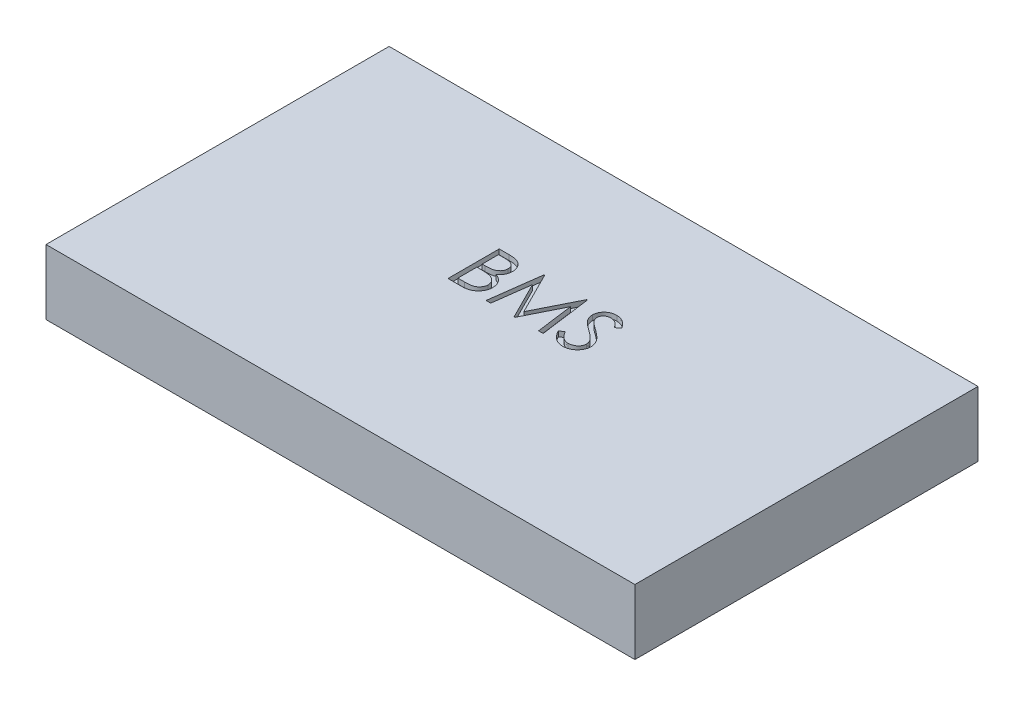
from build123d import *

# Parameters (mm, degrees)
SKETCH1_W           = 115
SKETCH1_H           = 67
BOSS_EXTRUDE1_DEPTH = 12.7
CUT_EXTRUDE1_DEPTH  = 1


with BuildPart() as part:
    # Sketch1 → Boss-Extrude1 (new body)
    with BuildSketch(Plane(origin=(0, 0, 0), x_dir=(1, 0, 0), z_dir=(0, 1, 0))):
        with Locations((57.5, 33.5)):
            Rectangle(SKETCH1_W, SKETCH1_H)
    extrude(amount=BOSS_EXTRUDE1_DEPTH)

    # Sketch2 → Cut-Extrude1 (cut)
    # profile 1 of 3: a face of its own
    with BuildSketch(Plane(origin=(0, 12.7, 0), x_dir=(1, 0, 0), z_dir=(0, 1, 0))):
        with BuildLine():
            Line((45, 43.5), (46.951121795, 43.5))
            add(Edge.make_bspline(
                [(46.951121795, 43.5), (47.046631733, 43.499497856), (47.231753762, 43.498524576), (47.500952167, 43.483429916), (47.753091626, 43.462848002), (47.988245262, 43.430190594), (48.206304411, 43.390785516), (48.407926232, 43.343066042), (48.592469581, 43.285847146), (48.812791685, 43.194857771), (49.063993574, 43.059648718), (49.335988981, 42.859852818), (49.568572522, 42.615474352), (49.769104857, 42.339809622), (49.928536628, 42.03656456), (50.043877477, 41.712966878), (50.116899978, 41.373190472), (50.12440979, 41.13992425), (50.128205128, 41.022035256)],
                knots=[0, 0, 0, 0, 1.001505555, 1.941167018, 2.826882275, 3.653841531, 4.429895133, 5.150066043, 5.825578002, 6.45369114, 7.647487171, 8.808567382, 9.977351308, 11.170798116, 12.373658725, 13.556498008, 14.765093433, 16, 16, 16, 16], degree=3))
            add(Edge.make_bspline(
                [(50.128205128, 41.022035256), (50.125081647, 40.911599383), (50.118943712, 40.694582477), (50.060250114, 40.377170736), (49.968362489, 40.075024397), (49.840633206, 39.789246153), (49.674627503, 39.526292972), (49.477889449, 39.284043641), (49.240527157, 39.072754907), (49.062689328, 38.954632328), (48.972355769, 38.89463141)],
                knots=[0, 0, 0, 0, 1.044552857, 2.05264487, 3.044412934, 4.028983338, 5.005914585, 5.980388656, 6.974128949, 8, 8, 8, 8], degree=3))
            add(Edge.make_bspline(
                [(48.972355769, 38.89463141), (49.085956991, 38.851017128), (49.303304269, 38.767572201), (49.602407162, 38.620042304), (49.860106719, 38.459579131), (50.078384279, 38.284345273), (50.265063293, 38.095462957), (50.428071697, 37.890162631), (50.567161338, 37.665766179), (50.68634112, 37.424613221), (50.779337565, 37.169166169), (50.848983006, 36.901821094), (50.888890004, 36.623536651), (50.894568979, 36.434149853), (50.897435897, 36.338541667)],
                knots=[0, 0, 0, 0, 1.27268992, 2.434971085, 3.483601985, 4.442670788, 5.356604649, 6.2567628, 7.179492994, 8.113709626, 9.066344395, 10.018646069, 10.999752585, 12, 12, 12, 12], degree=3))
            add(Edge.make_bspline(
                [(50.897435897, 36.338541667), (50.894644909, 36.240922032), (50.88915356, 36.048852666), (50.848639355, 35.766695139), (50.780041907, 35.497052434), (50.685552917, 35.238180484), (50.562232018, 34.990580099), (50.41215212, 34.753970774), (50.233204796, 34.530729829), (50.03302517, 34.31837662), (49.806561897, 34.127440085), (49.562231169, 33.957395209), (49.296955969, 33.817549317), (49.015093129, 33.70007497), (48.713480797, 33.610340117), (48.393473348, 33.547561334), (48.055346771, 33.505261229), (47.823318911, 33.5017835), (47.704326923, 33.5)],
                knots=[0, 0, 0, 0, 0.978564426, 1.925352924, 2.850884081, 3.763762016, 4.682927383, 5.618979971, 6.567305752, 7.547517671, 8.540179244, 9.531824382, 10.526200242, 11.540722885, 12.589160233, 13.674978461, 14.80764778, 16, 16, 16, 16], degree=3))
            Line((47.704326923, 33.5), (45, 33.5))
            Line((45, 33.5), (45, 43.5))
        make_face()
        with BuildLine():
            Line((45.897435897, 42.474358974), (45.897435897, 39.269230769))
            Line((45.897435897, 39.269230769), (46.500400641, 39.269230769))
            add(Edge.make_bspline(
                [(46.500400641, 39.269230769), (46.588540056, 39.270373406), (46.758843369, 39.272581214), (47.005471644, 39.278905549), (47.234400268, 39.296614244), (47.445234077, 39.31431785), (47.637641059, 39.343102386), (47.811194949, 39.377365595), (47.968619512, 39.413602466), (48.150161071, 39.475229572), (48.356083781, 39.566308644), (48.575606935, 39.707656747), (48.769133991, 39.876012042), (48.932554528, 40.070271932), (49.066301586, 40.284175321), (49.159197915, 40.514309265), (49.222190156, 40.754938213), (49.227880245, 40.920133221), (49.230769231, 41.00400641)],
                knots=[0, 0, 0, 0, 1.156816544, 2.235205308, 3.236616184, 4.169592532, 5.011045266, 5.787822928, 6.49130361, 7.128639758, 8.301311294, 9.436451833, 10.541879658, 11.654887649, 12.756523258, 13.837046038, 14.901820046, 16, 16, 16, 16], degree=3))
            add(Edge.make_bspline(
                [(49.230769231, 41.00400641), (49.229265859, 41.059508615), (49.226316831, 41.168382249), (49.202164537, 41.32709469), (49.161114325, 41.476362554), (49.108387773, 41.618231441), (49.034705805, 41.748265298), (48.947953053, 41.870960143), (48.843136795, 41.982137625), (48.723830187, 42.086050477), (48.586662693, 42.178177699), (48.431716145, 42.258865594), (48.256894211, 42.323839242), (48.065143196, 42.380742534), (47.853511518, 42.420709088), (47.624441365, 42.454004482), (47.376056454, 42.470955173), (47.204213304, 42.473199067), (47.115384615, 42.474358974)],
                knots=[0, 0, 0, 0, 0.91205012, 1.789085906, 2.630437955, 3.453916878, 4.269457761, 5.079663411, 5.91843418, 6.774407191, 7.675494373, 8.627863946, 9.638891023, 10.736472738, 11.911756761, 13.175263542, 14.539845004, 16, 16, 16, 16], degree=3))
            Line((47.115384615, 42.474358974), (45.897435897, 42.474358974))
        make_face(mode=Mode.SUBTRACT)
        with BuildLine():
            Line((45.897435897, 38.243589744), (45.897435897, 34.525641026))
            Line((45.897435897, 34.525641026), (47.175480769, 34.525641026))
            add(Edge.make_bspline(
                [(47.175480769, 34.525641026), (47.266963415, 34.526737447), (47.443284153, 34.528850654), (47.697859097, 34.535749381), (47.933810822, 34.551441598), (48.150062638, 34.576144025), (48.348949646, 34.602939594), (48.52808594, 34.638971825), (48.688923636, 34.68025457), (48.875421658, 34.74406649), (49.085431681, 34.843199265), (49.311748414, 34.992668483), (49.51296618, 35.170735076), (49.683838349, 35.376823403), (49.823875459, 35.600912908), (49.925748188, 35.838471051), (49.988579207, 36.085572558), (49.996185405, 36.254048879), (50, 36.338541667)],
                knots=[0, 0, 0, 0, 1.160039823, 2.235823828, 3.228722157, 4.157150951, 4.99529583, 5.772374946, 6.472645482, 7.099169577, 8.269452708, 9.405989375, 10.527446681, 11.663510218, 12.788923519, 13.866172445, 14.929861265, 16, 16, 16, 16], degree=3))
            add(Edge.make_bspline(
                [(50, 36.338541667), (49.99921113, 36.391379782), (49.997646116, 36.49620373), (49.974044359, 36.650248928), (49.939719017, 36.799465709), (49.895343491, 36.944259253), (49.830716443, 37.082011757), (49.755269171, 37.215447641), (49.666808023, 37.344743297), (49.52896755, 37.508206878), (49.328476165, 37.696541201), (49.043599664, 37.880934064), (48.719678813, 38.029642085), (48.484743119, 38.092783446), (48.36338141, 38.125400641)],
                knots=[0, 0, 0, 0, 0.723448775, 1.435228256, 2.130040452, 2.821711965, 3.505591119, 4.210454504, 4.921174351, 5.648778258, 7.137944449, 8.670945889, 10.280296675, 12, 12, 12, 12], degree=3))
            add(Edge.make_bspline(
                [(48.36338141, 38.125400641), (48.314726851, 38.135272309), (48.20923373, 38.156676123), (48.037212071, 38.179269561), (47.840823874, 38.199398304), (47.619615654, 38.214287326), (47.373307536, 38.22967745), (47.101373483, 38.235662653), (46.804924012, 38.242803396), (46.59923152, 38.243320923), (46.492387821, 38.243589744)],
                knots=[0, 0, 0, 0, 0.634451884, 1.375622551, 2.216452059, 3.157844607, 4.20941857, 5.370758133, 6.634282058, 8, 8, 8, 8], degree=3))
            Line((46.492387821, 38.243589744), (45.897435897, 38.243589744))
        make_face(mode=Mode.SUBTRACT)
    # profile 2 of 3: a face of its own
    with BuildSketch(Plane(origin=(0, 12.7, 0), x_dir=(1, 0, 0), z_dir=(0, 1, 0))):
        Polygon((52.435897436, 33.5), (53.756009615, 43.5), (53.884214744, 43.5), (58.012820513, 35.294871795), (62.129407051, 43.5), (62.257612179, 43.5), (63.58974359, 33.5), (62.692307692, 33.5), (61.730769231, 40.689503205), (58.122996795, 33.5), (57.918669872, 33.5), (54.294871795, 40.711538462), (53.339342949, 33.5), align=None)
    # profile 3 of 3: a face of its own
    with BuildSketch(Plane(origin=(0, 12.7, 0), x_dir=(1, 0, 0), z_dir=(0, 1, 0))):
        with BuildLine():
            Line((64.615384615, 35.429086538), (65.460737179, 35.935897436))
            add(Edge.make_bspline(
                [(65.460737179, 35.935897436), (65.539360714, 35.804284907), (65.690000373, 35.552120382), (65.941289971, 35.211383124), (66.201669717, 34.921776961), (66.473067813, 34.684986654), (66.753827665, 34.498561264), (67.045782104, 34.366554887), (67.347947278, 34.284223529), (67.553586767, 34.274223282), (67.65625, 34.269230769)],
                knots=[0, 0, 0, 0, 1.272034388, 2.437168799, 3.508375237, 4.49857839, 5.41946034, 6.295179144, 7.148887113, 8, 8, 8, 8], degree=3))
            add(Edge.make_bspline(
                [(67.65625, 34.269230769), (67.743926744, 34.271672691), (67.917746096, 34.276513806), (68.173638219, 34.323030383), (68.422157654, 34.394493608), (68.658182333, 34.496839127), (68.878455517, 34.620663372), (69.071617504, 34.770223879), (69.238606399, 34.937670181), (69.375203869, 35.124477766), (69.48000397, 35.325383905), (69.560552737, 35.531600909), (69.605252947, 35.746368247), (69.611986528, 35.890969569), (69.615384615, 35.963942308)],
                knots=[0, 0, 0, 0, 1.095163259, 2.171163733, 3.241058638, 4.321873601, 5.38011039, 6.391990106, 7.366004449, 8.327778327, 9.272591725, 10.192022065, 11.087607919, 12, 12, 12, 12], degree=3))
            add(Edge.make_bspline(
                [(69.615384615, 35.963942308), (69.611172299, 36.047201878), (69.602609276, 36.216456419), (69.530233618, 36.466169713), (69.416378627, 36.713291342), (69.311342502, 36.8661521), (69.256810897, 36.945512821)],
                knots=[0, 0, 0, 0, 0.938893495, 1.908633276, 2.914225137, 4, 4, 4, 4], degree=3))
            add(Edge.make_bspline(
                [(69.256810897, 36.945512821), (69.212037714, 37.002789459), (69.118042016, 37.123034598), (68.956449123, 37.302020985), (68.766831654, 37.486645039), (68.555678639, 37.683956631), (68.315298386, 37.884778907), (68.053219773, 38.098688272), (67.762751605, 38.317549921), (67.559038757, 38.46432868), (67.453926282, 38.540064103)],
                knots=[0, 0, 0, 0, 0.722233717, 1.516239348, 2.393582979, 3.351407094, 4.387010283, 5.505090956, 6.712668013, 8, 8, 8, 8], degree=3))
            add(Edge.make_bspline(
                [(67.453926282, 38.540064103), (67.348714864, 38.615002924), (67.147558646, 38.758280245), (66.86624841, 38.970921057), (66.614692802, 39.165332112), (66.394009897, 39.343343575), (66.204296764, 39.504979589), (66.044058446, 39.648687987), (65.917376855, 39.778355303), (65.846932338, 39.862473423), (65.815304487, 39.900240385)],
                knots=[0, 0, 0, 0, 1.452282411, 2.77665338, 3.964542531, 5.026858415, 5.96415736, 6.766646006, 7.446254459, 8, 8, 8, 8], degree=3))
            add(Edge.make_bspline(
                [(65.815304487, 39.900240385), (65.771097215, 39.95910049), (65.684157682, 40.074856786), (65.569397666, 40.255784951), (65.471857201, 40.440994281), (65.395393395, 40.630982466), (65.331004198, 40.823082262), (65.287695825, 41.019800107), (65.260577548, 41.220253303), (65.257800443, 41.355149019), (65.256410256, 41.422676282)],
                knots=[0, 0, 0, 0, 1.068054152, 2.10047183, 3.106115577, 4.101338837, 5.06977816, 6.043150881, 7.020423561, 8, 8, 8, 8], degree=3))
            add(Edge.make_bspline(
                [(65.256410256, 41.422676282), (65.260139425, 41.528475638), (65.267518054, 41.737812963), (65.329919532, 42.043615336), (65.428413513, 42.335576528), (65.566398907, 42.610806053), (65.744277059, 42.862137427), (65.9501227, 43.092461675), (66.195298375, 43.286086196), (66.46430587, 43.455263505), (66.758752647, 43.587680435), (67.067298085, 43.687568949), (67.390432577, 43.744166828), (67.609298676, 43.752289014), (67.720352564, 43.756410256)],
                knots=[0, 0, 0, 0, 1.005424448, 1.989358655, 2.955360095, 3.929531133, 4.905563448, 5.876582895, 6.856512386, 7.866279853, 8.892233794, 9.918561126, 10.94386622, 12, 12, 12, 12], degree=3))
            add(Edge.make_bspline(
                [(67.720352564, 43.756410256), (67.838192851, 43.752345823), (68.07253957, 43.744262963), (68.417251614, 43.673984302), (68.749139376, 43.557696668), (69.016120132, 43.425729074), (69.225070879, 43.293925029), (69.384421544, 43.173868388), (69.545899975, 43.035653792), (69.710808703, 42.878913089), (69.876353444, 42.702208086), (70.044991879, 42.506748975), (70.217118362, 42.293730244), (70.32784939, 42.141660242), (70.384615385, 42.063701923)],
                knots=[0, 0, 0, 0, 1.286793592, 2.559021753, 3.825965368, 5.121522368, 5.803751409, 6.523245864, 7.299691795, 8.125521123, 9.008227632, 9.944561021, 10.946284179, 12, 12, 12, 12], degree=3))
            Line((70.384615385, 42.063701923), (69.573317308, 41.448717949))
            add(Edge.make_bspline(
                [(69.573317308, 41.448717949), (69.524328929, 41.511828493), (69.429988766, 41.633364645), (69.286761661, 41.803568404), (69.151765524, 41.95904406), (69.018764382, 42.094087282), (68.894782577, 42.216093378), (68.774448171, 42.320549826), (68.659492882, 42.408480098), (68.514587423, 42.502318841), (68.332536799, 42.595337423), (68.104009553, 42.674049074), (67.865191624, 42.721349251), (67.702535534, 42.727603216), (67.620192308, 42.730769231)],
                knots=[0, 0, 0, 0, 1.181633172, 2.275549214, 3.290209073, 4.226197932, 5.078386478, 5.862611352, 6.581680152, 7.217281963, 8.414376989, 9.595101626, 10.782541182, 12, 12, 12, 12], degree=3))
            add(Edge.make_bspline(
                [(67.620192308, 42.730769231), (67.516887958, 42.727307231), (67.317675251, 42.72063109), (67.034846005, 42.647716847), (66.780291933, 42.532911531), (66.561570319, 42.372011594), (66.37946467, 42.181380186), (66.247734788, 41.962012029), (66.168448604, 41.719776593), (66.158773519, 41.550800432), (66.153846154, 41.46474359)],
                knots=[0, 0, 0, 0, 1.14458467, 2.207223713, 3.21896685, 4.227309161, 5.202851033, 6.127160689, 7.046193047, 8, 8, 8, 8], degree=3))
            add(Edge.make_bspline(
                [(66.153846154, 41.46474359), (66.154969373, 41.411167937), (66.157217647, 41.303929024), (66.188574212, 41.14549639), (66.228858009, 40.987463992), (66.2926941, 40.830542326), (66.380823539, 40.671987015), (66.496552613, 40.509067765), (66.642304933, 40.340348597), (66.75395354, 40.230613243), (66.812900641, 40.172676282)],
                knots=[0, 0, 0, 0, 0.858281714, 1.717966888, 2.583508476, 3.4729293, 4.427298488, 5.488583878, 6.674047936, 8, 8, 8, 8], degree=3))
            add(Edge.make_bspline(
                [(66.812900641, 40.172676282), (66.834790276, 40.153141923), (66.88679504, 40.106732756), (66.981869113, 40.030754811), (67.107419965, 39.937032605), (67.260169112, 39.821068843), (67.442933002, 39.68655038), (67.655731734, 39.535197203), (67.896193256, 39.362095891), (68.066827302, 39.241074346), (68.157051282, 39.177083333)],
                knots=[0, 0, 0, 0, 0.420754252, 0.999615792, 1.744751191, 2.668019286, 3.750313428, 4.999500688, 6.413464383, 8, 8, 8, 8], degree=3))
            add(Edge.make_bspline(
                [(68.157051282, 39.177083333), (68.265582463, 39.09810802), (68.475738053, 38.945183272), (68.774759709, 38.715424187), (69.045884875, 38.490716276), (69.290065457, 38.272494542), (69.509713767, 38.062414276), (69.702392969, 37.857948047), (69.870066341, 37.660560696), (70.050578394, 37.407496194), (70.235029307, 37.096693096), (70.393433614, 36.715898129), (70.493314607, 36.333622928), (70.506376079, 36.076689109), (70.512820513, 35.949919872)],
                knots=[0, 0, 0, 0, 1.163667725, 2.253281268, 3.268753668, 4.215851969, 5.092017293, 5.902905408, 6.650798638, 7.335211899, 8.59617414, 9.77448103, 10.901945474, 12, 12, 12, 12], degree=3))
            add(Edge.make_bspline(
                [(70.512820513, 35.949919872), (70.510942975, 35.8602674), (70.507224361, 35.682703447), (70.464478893, 35.421974656), (70.401851278, 35.1687436), (70.307459181, 34.926140421), (70.192250158, 34.689726814), (70.046060878, 34.465704241), (69.87661035, 34.249114531), (69.682228165, 34.045733127), (69.469525587, 33.85902971), (69.24471503, 33.692946677), (69.007428536, 33.554465753), (68.758953346, 33.441463347), (68.499232384, 33.353081869), (68.228353001, 33.2890451), (67.945868684, 33.249743068), (67.753867308, 33.24566375), (67.65625, 33.243589744)],
                knots=[0, 0, 0, 0, 0.983748083, 1.948392443, 2.894712957, 3.844097841, 4.80183111, 5.778335162, 6.776009319, 7.81870978, 8.863265674, 9.881300176, 10.883814829, 11.87499822, 12.874611388, 13.892143829, 14.928324115, 16, 16, 16, 16], degree=3))
            add(Edge.make_bspline(
                [(67.65625, 33.243589744), (67.580720449, 33.245050262), (67.430612563, 33.247952906), (67.208585472, 33.273613708), (66.991043788, 33.309919718), (66.780717268, 33.367559918), (66.574896092, 33.437494138), (66.374475422, 33.52360366), (66.179358125, 33.626795664), (65.988450746, 33.744781448), (65.802238818, 33.88208929), (65.62246891, 34.042013566), (65.443242666, 34.22014358), (65.269850105, 34.421316618), (65.098783978, 34.642282569), (64.933417094, 34.885108807), (64.770326472, 35.148472675), (64.667996564, 35.333801492), (64.615384615, 35.429086538)],
                knots=[0, 0, 0, 0, 0.915332311, 1.819136955, 2.706846663, 3.586547465, 4.459518054, 5.340707479, 6.227863349, 7.133153174, 8.059268498, 9.028702269, 10.047606654, 11.120612155, 12.245963614, 13.433783089, 14.680604001, 16, 16, 16, 16], degree=3))
        make_face()
    extrude(amount=-CUT_EXTRUDE1_DEPTH, mode=Mode.SUBTRACT)


solid = part.part
